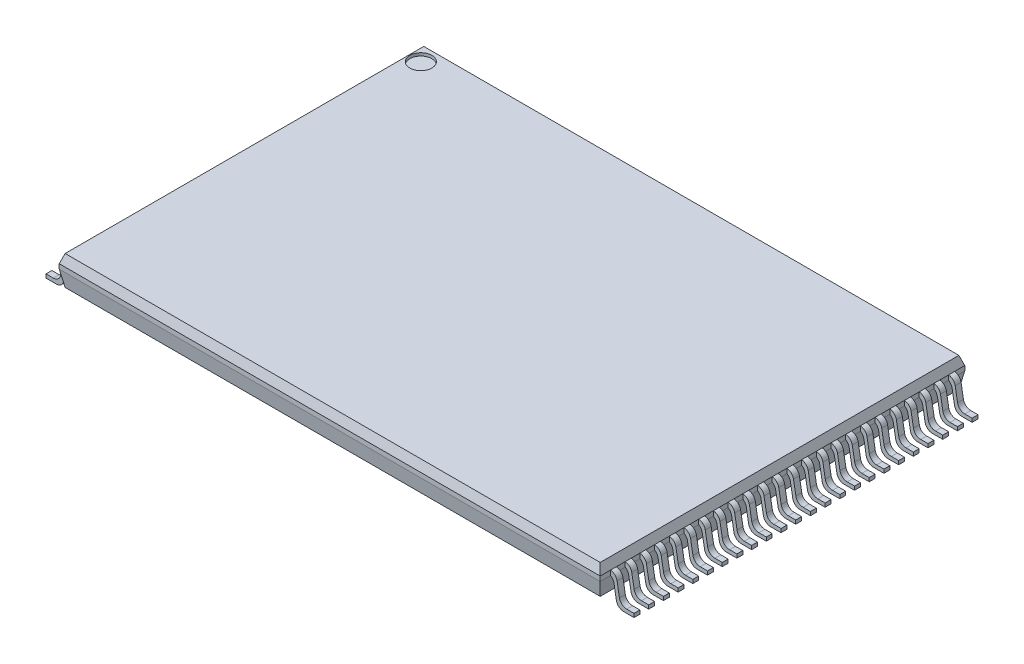
from build123d import *

# Parameters (mm, degrees)
BOSS_EXTRUDE1_DEPTH = 0.2
LPATTERN1_COUNT     = 24
LPATTERN1_PITCH     = 0.5
SKETCH2_W           = 18.4
SKETCH2_H           = 12.4
BOSS_EXTRUDE2_DEPTH = 0.7
SKETCH4_W           = 18.4
SKETCH4_H           = 12.4
BOSS_EXTRUDE3_DEPTH = 0.3
CUT_EXTRUDE1_DEPTH  = 23.687778564
CUT_EXTRUDE2_DEPTH  = 23.680992594
SKETCH7_R           = 0.375
CUT_EXTRUDE4_DEPTH  = 0.1


with BuildPart() as part:
    # Sketch1 → Boss-Extrude1 (new body)
    with BuildSketch(Plane.XY):
        with BuildLine():
            Line((-0.416378295, -0.328608127), (-0.334946247, 0.133215962))
            ThreePointArc((-0.334946247, 0.133215962), (-0.249441211, 0.281315028), (-0.088744309, 0.339803918))
            Line((-0.088744309, 0.339803918), (-0.016049644, 0.339803918))
            Line((-0.016049644, 0.339803918), (-0.016049644, 0.464803918))
            Line((-0.016049644, 0.464803918), (-0.193631763, 0.464803918))
            ThreePointArc((-0.193631763, 0.464803918), (-0.354328665, 0.406315028), (-0.439833701, 0.258215962))
            Line((-0.439833701, 0.258215962), (-0.521265748, -0.203608127))
            ThreePointArc((-0.521265748, -0.203608127), (-0.606770784, -0.351707193), (-0.767467687, -0.410196082))
            Line((-0.767467687, -0.410196082), (-1.016049644, -0.410196082))
            Line((-1.016049644, -0.410196082), (-1.016049644, -0.535196082))
            Line((-1.016049644, -0.535196082), (-0.662580233, -0.535196082))
            ThreePointArc((-0.662580233, -0.535196082), (-0.50188333, -0.476707193), (-0.416378295, -0.328608127))
        make_face()
    extrude(amount=BOSS_EXTRUDE1_DEPTH)


with BuildPart() as lpattern1_1:
    # LPattern1: pattern copy
    add(part.part.moved(Location(Vector(0, 0, 1) * (1 * LPATTERN1_PITCH))))


with BuildPart() as lpattern1_2:
    # LPattern1: pattern copy
    add(part.part.moved(Location(Vector(0, 0, 1) * (2 * LPATTERN1_PITCH))))


with BuildPart() as lpattern1_3:
    # LPattern1: pattern copy
    add(part.part.moved(Location(Vector(0, 0, 1) * (3 * LPATTERN1_PITCH))))


with BuildPart() as lpattern1_4:
    # LPattern1: pattern copy
    add(part.part.moved(Location(Vector(0, 0, 1) * (4 * LPATTERN1_PITCH))))


with BuildPart() as lpattern1_5:
    # LPattern1: pattern copy
    add(part.part.moved(Location(Vector(0, 0, 1) * (5 * LPATTERN1_PITCH))))


with BuildPart() as lpattern1_6:
    # LPattern1: pattern copy
    add(part.part.moved(Location(Vector(0, 0, 1) * (6 * LPATTERN1_PITCH))))


with BuildPart() as lpattern1_7:
    # LPattern1: pattern copy
    add(part.part.moved(Location(Vector(0, 0, 1) * (7 * LPATTERN1_PITCH))))


with BuildPart() as lpattern1_8:
    # LPattern1: pattern copy
    add(part.part.moved(Location(Vector(0, 0, 1) * (8 * LPATTERN1_PITCH))))


with BuildPart() as lpattern1_9:
    # LPattern1: pattern copy
    add(part.part.moved(Location(Vector(0, 0, 1) * (9 * LPATTERN1_PITCH))))


with BuildPart() as lpattern1_10:
    # LPattern1: pattern copy
    add(part.part.moved(Location(Vector(0, 0, 1) * (10 * LPATTERN1_PITCH))))


with BuildPart() as lpattern1_11:
    # LPattern1: pattern copy
    add(part.part.moved(Location(Vector(0, 0, 1) * (11 * LPATTERN1_PITCH))))


with BuildPart() as lpattern1_12:
    # LPattern1: pattern copy
    add(part.part.moved(Location(Vector(0, 0, 1) * (12 * LPATTERN1_PITCH))))


with BuildPart() as lpattern1_13:
    # LPattern1: pattern copy
    add(part.part.moved(Location(Vector(0, 0, 1) * (13 * LPATTERN1_PITCH))))


with BuildPart() as lpattern1_14:
    # LPattern1: pattern copy
    add(part.part.moved(Location(Vector(0, 0, 1) * (14 * LPATTERN1_PITCH))))


with BuildPart() as lpattern1_15:
    # LPattern1: pattern copy
    add(part.part.moved(Location(Vector(0, 0, 1) * (15 * LPATTERN1_PITCH))))


with BuildPart() as lpattern1_16:
    # LPattern1: pattern copy
    add(part.part.moved(Location(Vector(0, 0, 1) * (16 * LPATTERN1_PITCH))))


with BuildPart() as lpattern1_17:
    # LPattern1: pattern copy
    add(part.part.moved(Location(Vector(0, 0, 1) * (17 * LPATTERN1_PITCH))))


with BuildPart() as lpattern1_18:
    # LPattern1: pattern copy
    add(part.part.moved(Location(Vector(0, 0, 1) * (18 * LPATTERN1_PITCH))))


with BuildPart() as lpattern1_19:
    # LPattern1: pattern copy
    add(part.part.moved(Location(Vector(0, 0, 1) * (19 * LPATTERN1_PITCH))))


with BuildPart() as lpattern1_20:
    # LPattern1: pattern copy
    add(part.part.moved(Location(Vector(0, 0, 1) * (20 * LPATTERN1_PITCH))))


with BuildPart() as lpattern1_21:
    # LPattern1: pattern copy
    add(part.part.moved(Location(Vector(0, 0, 1) * (21 * LPATTERN1_PITCH))))


with BuildPart() as lpattern1_22:
    # LPattern1: pattern copy
    add(part.part.moved(Location(Vector(0, 0, 1) * (22 * LPATTERN1_PITCH))))


with BuildPart() as lpattern1_23:
    # LPattern1: pattern copy
    add(part.part.moved(Location(Vector(0, 0, 1) * (23 * LPATTERN1_PITCH))))


with BuildPart() as body_25:
    # Mirror1: mirrored copy
    add(part.part.mirror(Plane.ZY.offset(-8.983950356)))


with BuildPart() as body_26:
    # Mirror1 2: mirrored copy
    add(lpattern1_1.part.mirror(Plane.ZY.offset(-8.983950356)))


with BuildPart() as body_27:
    # Mirror1 3: mirrored copy
    add(lpattern1_2.part.mirror(Plane.ZY.offset(-8.983950356)))


with BuildPart() as body_28:
    # Mirror1 4: mirrored copy
    add(lpattern1_3.part.mirror(Plane.ZY.offset(-8.983950356)))


with BuildPart() as body_29:
    # Mirror1 5: mirrored copy
    add(lpattern1_4.part.mirror(Plane.ZY.offset(-8.983950356)))


with BuildPart() as body_30:
    # Mirror1 6: mirrored copy
    add(lpattern1_5.part.mirror(Plane.ZY.offset(-8.983950356)))


with BuildPart() as body_31:
    # Mirror1 7: mirrored copy
    add(lpattern1_6.part.mirror(Plane.ZY.offset(-8.983950356)))


with BuildPart() as body_32:
    # Mirror1 8: mirrored copy
    add(lpattern1_8.part.mirror(Plane.ZY.offset(-8.983950356)))


with BuildPart() as body_33:
    # Mirror1 9: mirrored copy
    add(lpattern1_7.part.mirror(Plane.ZY.offset(-8.983950356)))


with BuildPart() as body_34:
    # Mirror1 10: mirrored copy
    add(lpattern1_9.part.mirror(Plane.ZY.offset(-8.983950356)))


with BuildPart() as body_35:
    # Mirror1 11: mirrored copy
    add(lpattern1_10.part.mirror(Plane.ZY.offset(-8.983950356)))


with BuildPart() as body_36:
    # Mirror1 12: mirrored copy
    add(lpattern1_11.part.mirror(Plane.ZY.offset(-8.983950356)))


with BuildPart() as body_37:
    # Mirror1 13: mirrored copy
    add(lpattern1_12.part.mirror(Plane.ZY.offset(-8.983950356)))


with BuildPart() as body_38:
    # Mirror1 14: mirrored copy
    add(lpattern1_13.part.mirror(Plane.ZY.offset(-8.983950356)))


with BuildPart() as body_39:
    # Mirror1 15: mirrored copy
    add(lpattern1_14.part.mirror(Plane.ZY.offset(-8.983950356)))


with BuildPart() as body_40:
    # Mirror1 16: mirrored copy
    add(lpattern1_15.part.mirror(Plane.ZY.offset(-8.983950356)))


with BuildPart() as body_41:
    # Mirror1 17: mirrored copy
    add(lpattern1_16.part.mirror(Plane.ZY.offset(-8.983950356)))


with BuildPart() as body_42:
    # Mirror1 18: mirrored copy
    add(lpattern1_17.part.mirror(Plane.ZY.offset(-8.983950356)))


with BuildPart() as body_43:
    # Mirror1 19: mirrored copy
    add(lpattern1_18.part.mirror(Plane.ZY.offset(-8.983950356)))


with BuildPart() as body_44:
    # Mirror1 20: mirrored copy
    add(lpattern1_19.part.mirror(Plane.ZY.offset(-8.983950356)))


with BuildPart() as body_45:
    # Mirror1 21: mirrored copy
    add(lpattern1_20.part.mirror(Plane.ZY.offset(-8.983950356)))


with BuildPart() as body_46:
    # Mirror1 22: mirrored copy
    add(lpattern1_21.part.mirror(Plane.ZY.offset(-8.983950356)))


with BuildPart() as body_47:
    # Mirror1 23: mirrored copy
    add(lpattern1_22.part.mirror(Plane.ZY.offset(-8.983950356)))


with BuildPart() as body_48:
    # Mirror1 24: mirrored copy
    add(lpattern1_23.part.mirror(Plane.ZY.offset(-8.983950356)))


with BuildPart() as part_1:
    add(part.part)

    add(lpattern1_1.part)  # Boss-Extrude2 merges LPattern1_1

    add(lpattern1_2.part)  # Boss-Extrude2 merges LPattern1_2

    add(lpattern1_3.part)  # Boss-Extrude2 merges LPattern1_3

    add(lpattern1_4.part)  # Boss-Extrude2 merges LPattern1_4

    add(lpattern1_5.part)  # Boss-Extrude2 merges LPattern1_5

    add(lpattern1_6.part)  # Boss-Extrude2 merges LPattern1_6

    add(lpattern1_7.part)  # Boss-Extrude2 merges LPattern1_7

    add(lpattern1_8.part)  # Boss-Extrude2 merges LPattern1_8

    add(lpattern1_9.part)  # Boss-Extrude2 merges LPattern1_9

    add(lpattern1_10.part)  # Boss-Extrude2 merges LPattern1_10

    add(lpattern1_11.part)  # Boss-Extrude2 merges LPattern1_11

    add(lpattern1_12.part)  # Boss-Extrude2 merges LPattern1_12

    add(lpattern1_13.part)  # Boss-Extrude2 merges LPattern1_13

    add(lpattern1_14.part)  # Boss-Extrude2 merges LPattern1_14

    add(lpattern1_15.part)  # Boss-Extrude2 merges LPattern1_15

    add(lpattern1_16.part)  # Boss-Extrude2 merges LPattern1_16

    add(lpattern1_17.part)  # Boss-Extrude2 merges LPattern1_17

    add(lpattern1_18.part)  # Boss-Extrude2 merges LPattern1_18

    add(lpattern1_19.part)  # Boss-Extrude2 merges LPattern1_19

    add(lpattern1_20.part)  # Boss-Extrude2 merges LPattern1_20

    add(lpattern1_21.part)  # Boss-Extrude2 merges LPattern1_21

    add(lpattern1_22.part)  # Boss-Extrude2 merges LPattern1_22

    add(lpattern1_23.part)  # Boss-Extrude2 merges LPattern1_23

    add(body_25.part)  # Boss-Extrude2 merges body 25

    add(body_26.part)  # Boss-Extrude2 merges body 26

    add(body_27.part)  # Boss-Extrude2 merges body 27

    add(body_28.part)  # Boss-Extrude2 merges body 28

    add(body_29.part)  # Boss-Extrude2 merges body 29

    add(body_30.part)  # Boss-Extrude2 merges body 30

    add(body_31.part)  # Boss-Extrude2 merges body 31

    add(body_32.part)  # Boss-Extrude2 merges body 32

    add(body_33.part)  # Boss-Extrude2 merges body 33

    add(body_34.part)  # Boss-Extrude2 merges body 34

    add(body_35.part)  # Boss-Extrude2 merges body 35

    add(body_36.part)  # Boss-Extrude2 merges body 36

    add(body_37.part)  # Boss-Extrude2 merges body 37

    add(body_38.part)  # Boss-Extrude2 merges body 38

    add(body_39.part)  # Boss-Extrude2 merges body 39

    add(body_40.part)  # Boss-Extrude2 merges body 40

    add(body_41.part)  # Boss-Extrude2 merges body 41

    add(body_42.part)  # Boss-Extrude2 merges body 42

    add(body_43.part)  # Boss-Extrude2 merges body 43

    add(body_44.part)  # Boss-Extrude2 merges body 44

    add(body_45.part)  # Boss-Extrude2 merges body 45

    add(body_46.part)  # Boss-Extrude2 merges body 46

    add(body_47.part)  # Boss-Extrude2 merges body 47

    add(body_48.part)  # Boss-Extrude2 merges body 48
    # Sketch2 → Boss-Extrude2 (add)
    with BuildSketch(Plane(origin=(0, 0.464803918, 0), x_dir=(1, 0, 0), z_dir=(0, 1, 0))):
        with Locations((8.983950356, -5.85)):
            Rectangle(SKETCH2_W, SKETCH2_H)
    extrude(amount=-BOSS_EXTRUDE2_DEPTH)

    # Sketch4 → Boss-Extrude3 (add)
    with BuildSketch(Plane(origin=(0, 0.464803918, 0), x_dir=(1, 0, 0), z_dir=(0, 1, 0))):
        with Locations((8.983950356, -5.85)):
            Rectangle(SKETCH4_W, SKETCH4_H)
    extrude(amount=BOSS_EXTRUDE3_DEPTH)

    # Sketch5 → Cut-Extrude1 (cut, through all)
    with BuildSketch(Plane.XY.offset(12.05)):
        Polygon((18.183950356, 0.764803918), (18.183950356, 0.463796766), (18.083950356, 0.764803918), align=None)
        Polygon((18.183950356, 0.304962817), (18.183950356, -0.235196082), (18.083950356, -0.235196082), align=None)
        Polygon((-0.216049644, 0.463796766), (-0.216049644, 0.764803918), (-0.116049644, 0.764803918), align=None)
        Polygon((-0.216049644, 0.304962817), (-0.216049644, -0.235196082), (-0.116049644, -0.235196082), align=None)
    extrude(amount=-CUT_EXTRUDE1_DEPTH, mode=Mode.SUBTRACT)

    # Sketch6 → Cut-Extrude2 (cut, through all)
    with BuildSketch(Plane.ZY.offset(0.216049644)):
        Polygon((-0.35, 0.463796766), (-0.35, 0.764803918), (-0.25, 0.764803918), align=None)
        Polygon((-0.35, 0.304962817), (-0.35, -0.235196082), (-0.25, -0.235196082), align=None)
        Polygon((12.05, 0.463796766), (12.05, 0.764803918), (11.95, 0.764803918), align=None)
        Polygon((12.05, -0.235196082), (12.05, 0.304962817), (11.95, -0.235196082), align=None)
    extrude(amount=-CUT_EXTRUDE2_DEPTH, mode=Mode.SUBTRACT)

    # Sketch7 → Cut-Extrude4 (cut)
    with BuildSketch(Plane(origin=(0, 0.764803918, 0), x_dir=(1, 0, 0), z_dir=(0, 1, 0))):
        with Locations((0.283950356, -0.25)):
            Circle(SKETCH7_R)
    extrude(amount=-CUT_EXTRUDE4_DEPTH, mode=Mode.SUBTRACT)


solid = part_1.part
